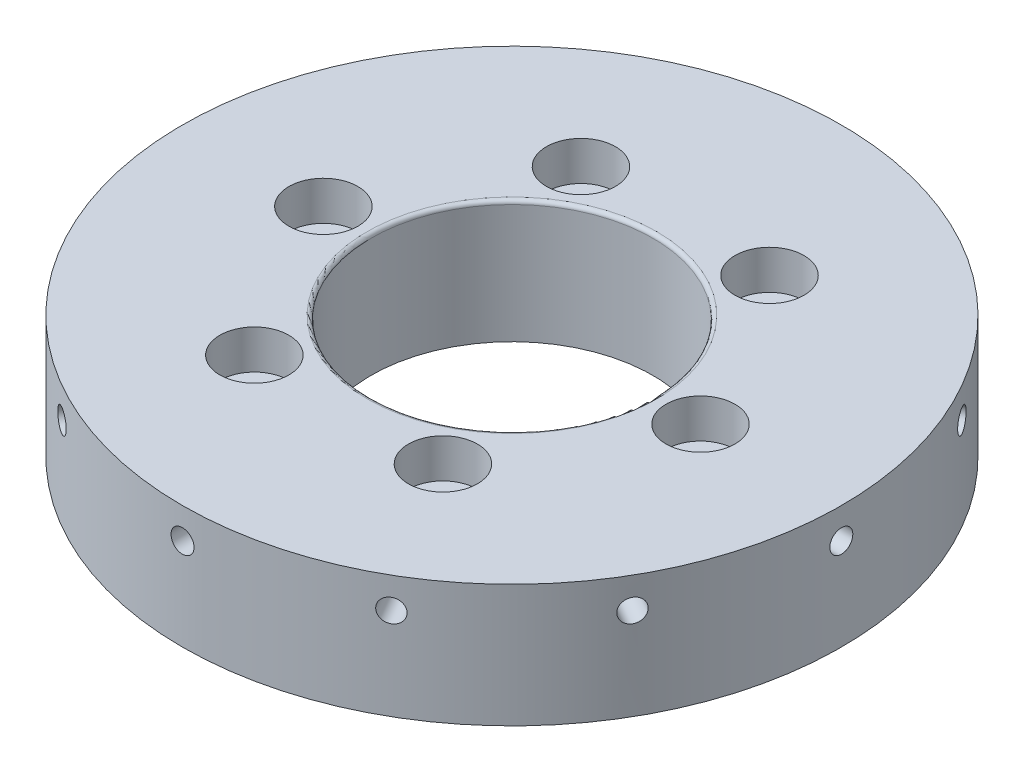
from build123d import *

# Parameters (mm, degrees)
SKETCH_1_R               = 43
SKETCH_1_R_2             = 2.5
SKETCH_1_R_3             = 18.4
EXTRUDE_1_DEPTH          = 16
SKETCH_2_R               = 4
CUT_EXTRUDE_1_DEPTH      = 3
SKETCH_4_R               = 4.5
CUT_EXTRUDE_2_DEPTH      = 5.1
SKETCH_5_R               = 1.5
CUT_EXTRUDE_3_DEPTH      = 10
PATTERN_CIRCULAR_1_COUNT = 12
FILLET_1_R               = 0.5


with BuildPart() as part:
    # 草图1 → 凸台-拉伸1 (new body)
    with BuildSketch(Plane(origin=(0, 0, 0), x_dir=(1, 0, 0), z_dir=(0, 1, 0))):
        Circle(SKETCH_1_R)
        with Locations((-24.6, 0)):
            Circle(SKETCH_1_R_2, mode=Mode.SUBTRACT)
        with Locations((-12.3, 21.304224933)):
            Circle(SKETCH_1_R_2, mode=Mode.SUBTRACT)
        with Locations((12.3, 21.304224933)):
            Circle(SKETCH_1_R_2, mode=Mode.SUBTRACT)
        with Locations((24.6, 0)):
            Circle(SKETCH_1_R_2, mode=Mode.SUBTRACT)
        with Locations((12.3, -21.304224933)):
            Circle(SKETCH_1_R_2, mode=Mode.SUBTRACT)
        with Locations((-12.3, -21.304224933)):
            Circle(SKETCH_1_R_2, mode=Mode.SUBTRACT)
        Circle(SKETCH_1_R_3, mode=Mode.SUBTRACT)
    extrude(amount=EXTRUDE_1_DEPTH)

    # 草图2 → 切除-拉伸1 (cut)
    with BuildSketch(Plane.XZ):
        with Locations((-21.304224933, -12.3)):
            Circle(SKETCH_2_R)
        with Locations((0, 24.6)):
            Circle(SKETCH_2_R)
        with Locations((21.304224933, -12.3)):
            Circle(SKETCH_2_R)
    extrude(amount=-CUT_EXTRUDE_1_DEPTH, mode=Mode.SUBTRACT)

    # 草图4 → 切除-拉伸2 (cut)
    with BuildSketch(Plane(origin=(0, 16, 0), x_dir=(1, 0, 0), z_dir=(0, 1, 0))):
        with Locations((-24.6, 0)):
            Circle(SKETCH_4_R)
        with Locations((-12.3, 21.304224933)):
            Circle(SKETCH_4_R)
        with Locations((12.3, 21.304224933)):
            Circle(SKETCH_4_R)
        with Locations((24.6, 0)):
            Circle(SKETCH_4_R)
        with Locations((12.3, -21.304224933)):
            Circle(SKETCH_4_R)
        with Locations((-12.3, -21.304224933)):
            Circle(SKETCH_4_R)
    extrude(amount=-CUT_EXTRUDE_2_DEPTH, mode=Mode.SUBTRACT)

    # 草图5 → 切除-拉伸3 (cut)
    with BuildSketch(Plane(origin=(43, 0, 0), x_dir=(0, 0, -1), z_dir=(1, 0, 0))):
        with Locations((0, 12)):
            Circle(SKETCH_5_R)
    cut_extrude_3 = extrude(amount=-CUT_EXTRUDE_3_DEPTH, mode=Mode.SUBTRACT)

    # 阵列(圆周)1: 切除-拉伸3 ×12 about axis
    pattern_circular_1_axis = Axis((0, 16, 0), (0, -1, 0))
    for i in range(1, PATTERN_CIRCULAR_1_COUNT):
        add(cut_extrude_3.rotate(pattern_circular_1_axis, i * 360 / PATTERN_CIRCULAR_1_COUNT), mode=Mode.SUBTRACT)

    # 圆角1
    fillet_1_edges = [part.edges().sort_by_distance(p)[0] for p in [
        (-18.4, 16, 0),
    ]]
    fillet(fillet_1_edges, radius=FILLET_1_R)


solid = part.part
